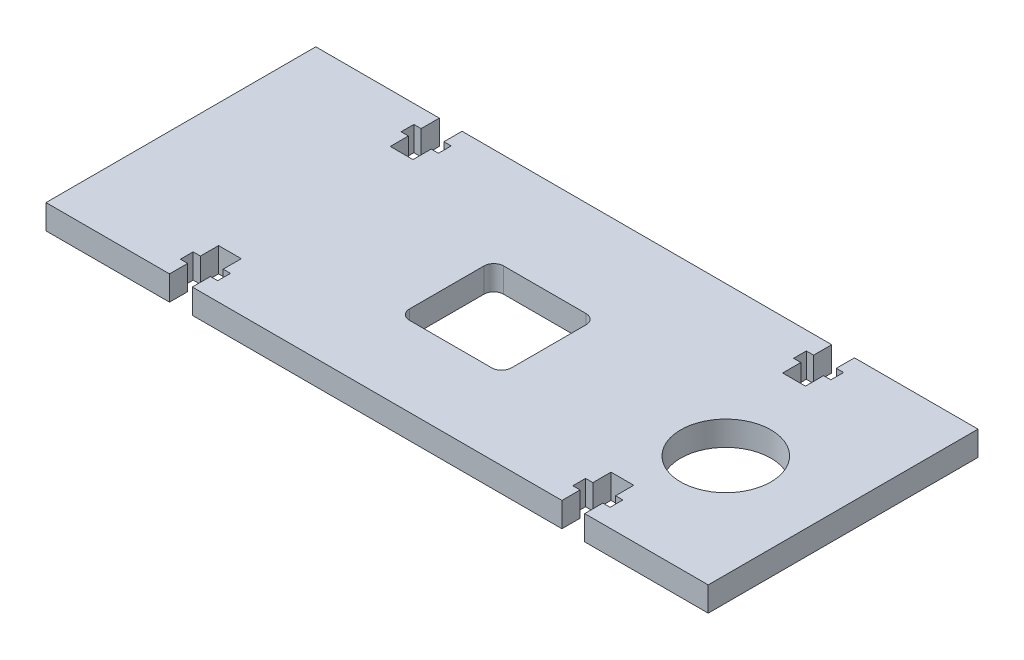
from build123d import *

# Parameters (mm, degrees)
SKETCH1_W           = 85.725
SKETCH1_H           = 34.925
BOSS_EXTRUDE1_DEPTH = 3.175
SKETCH2_R           = 5.842
SKETCH2_W           = 13.208
SKETCH2_H           = 12.192
CUT_EXTRUDE1_DEPTH  = 47.391954448
FILLET1_R           = 1.27
CUT_EXTRUDE2_DEPTH  = 47.391954448


with BuildPart() as part:
    # Sketch1 → Boss-Extrude1 (new body)
    with BuildSketch(Plane(origin=(0, 0, 0), x_dir=(1, 0, 0), z_dir=(0, 1, 0))):
        Rectangle(SKETCH1_W, SKETCH1_H)
    extrude(amount=BOSS_EXTRUDE1_DEPTH)

    # Sketch2 → Cut-Extrude1 (cut, through all)
    with BuildSketch(Plane(origin=(0, 0, 0), x_dir=(-1, 0, 0), z_dir=(0, -1, 0))):
        with Locations((-29.5375, -1.8635)):
            Circle(SKETCH2_R)
        with Locations((0.8075, -1.0435)):
            Rectangle(SKETCH2_W, SKETCH2_H)
    extrude(amount=-CUT_EXTRUDE1_DEPTH, mode=Mode.SUBTRACT)

    # Fillet1
    fillet1_edges = [part.edges().sort_by_distance(p)[0] for p in [
        (5.7965, 1.5875, -5.0525),
        (-7.4115, 1.5875, -5.0525),
        (5.7965, 1.5875, 7.1395),
        (-7.4115, 1.5875, 7.1395),
    ]]
    fillet(fillet1_edges, radius=FILLET1_R)

    # Sketch3 → Cut-Extrude2 (cut, through all)
    with BuildSketch(Plane.XZ):
        Polygon((-26.8732, 17.4625), (-23.9268, 17.4625), (-23.9268, 15.113), (-22.987, 15.113), (-22.987, 13.462), (-23.9268, 13.462), (-23.9268, 11.1125), (-26.8732, 11.1125), (-26.8732, 13.462), (-27.813, 13.462), (-27.813, 15.113), (-26.8732, 15.113), align=None)
        Polygon((26.8732, 13.462), (26.8732, 11.1125), (23.9268, 11.1125), (23.9268, 13.462), (22.987, 13.462), (22.987, 15.113), (23.9268, 15.113), (23.9268, 17.4625), (26.8732, 17.4625), (26.8732, 15.113), (27.813, 15.113), (27.813, 13.462), align=None)
        Polygon((26.8732, -17.4625), (23.9268, -17.4625), (23.9268, -15.113), (22.987, -15.113), (22.987, -13.462), (23.9268, -13.462), (23.9268, -11.1125), (26.8732, -11.1125), (26.8732, -13.462), (27.813, -13.462), (27.813, -15.113), (26.8732, -15.113), align=None)
        Polygon((-26.8732, -13.462), (-26.8732, -11.1125), (-23.9268, -11.1125), (-23.9268, -13.462), (-22.987, -13.462), (-22.987, -15.113), (-23.9268, -15.113), (-23.9268, -17.4625), (-26.8732, -17.4625), (-26.8732, -15.113), (-27.813, -15.113), (-27.813, -13.462), align=None)
    extrude(amount=-CUT_EXTRUDE2_DEPTH, mode=Mode.SUBTRACT)


solid = part.part
